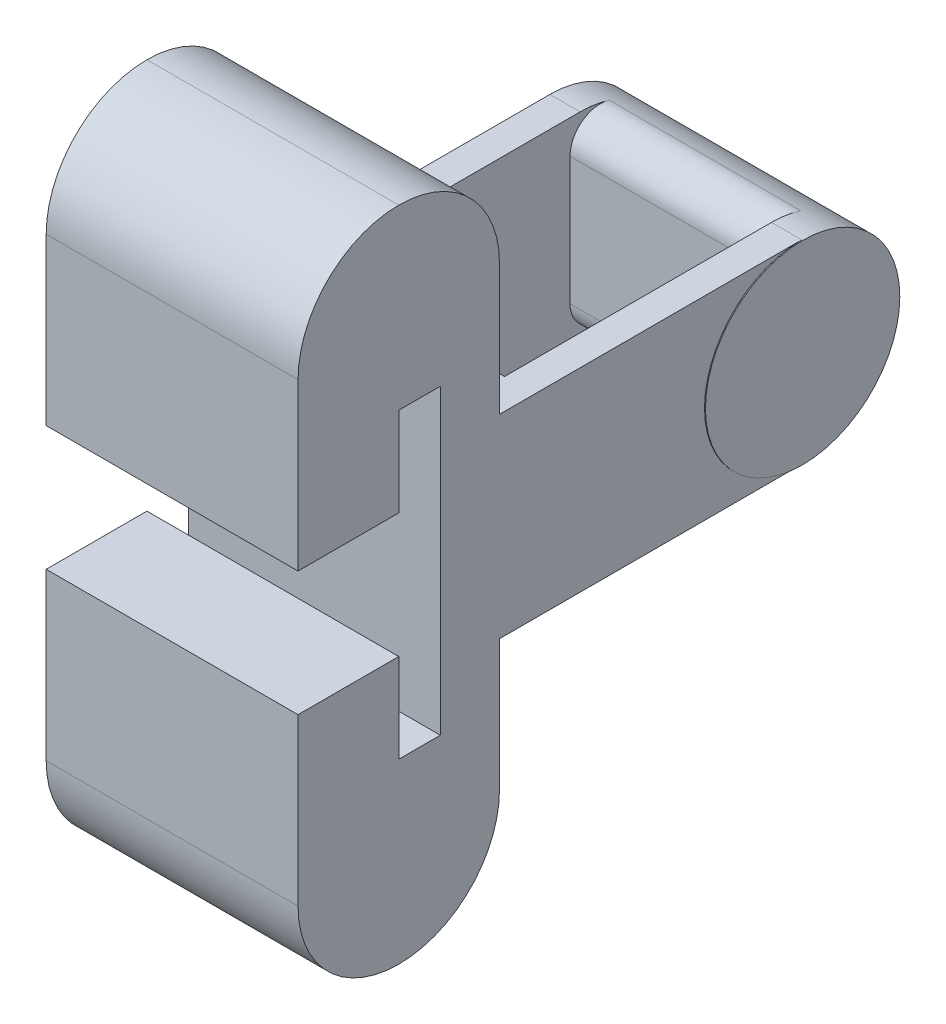
from build123d import *

# Parameters (mm, degrees)
SKETCH1_R            = 24.505905818
BOSS_EXTRUDE1_DEPTH  = 0.2286
BOSS_EXTRUDE2_START  = 63.5
BOSS_EXTRUDE2_DEPTH  = 63.5
SKETCH4_W            = 63.5
SKETCH4_H            = 76.2
BOSS_EXTRUDE4_DEPTH  = 14.929782549
SKETCH5_W            = 63.5
SKETCH5_H            = 50.8
BOSS_EXTRUDE5_DEPTH  = 44.789347647
FILLET2_R            = 25.4
SKETCH7_W            = 63.5
SKETCH7_H            = 25.4
BOSS_EXTRUDE7_DEPTH  = 22.41804
FILLET2_OF_MIRROR1_R = 25.4
SKETCH10_W           = 48.26
SKETCH10_H           = 64.77
CUT_EXTRUDE2_DEPTH   = 179.030869421
FILLET3_R            = 7.62


# Some blends are built 0.0001 mm under size
with BuildPart() as part:
    # Sketch1 → Boss-Extrude1 (new body)
    with BuildSketch(Plane.YZ):
        with Locations(Location((0, 0, 0), (0, 0, 270))):
            Circle(SKETCH1_R)
    extrude(amount=BOSS_EXTRUDE1_DEPTH)

    # Sketch2 → Boss-Extrude2 (add)
    with BuildSketch(Plane(origin=(0, 0, 0), x_dir=(0, -1, 0), z_dir=(-1, 0, 0)).offset(BOSS_EXTRUDE2_START)):
        with BuildLine():
            Line((-24.505905818, 0), (-24.505905818, 76.2))
            Line((-24.505905818, 76.2), (24.505905818, 76.2))
            Line((24.505905818, 76.2), (24.505905818, 0))
            ThreePointArc((24.505905818, 0), (0, -24.505905818), (-24.505905818, 0))
        make_face()
    extrude(amount=-BOSS_EXTRUDE2_DEPTH)

    # Sketch4 → Boss-Extrude4 (add)
    with BuildSketch(Plane.XY.offset(76.2)):
        with Locations((-31.75, 0)):
            Rectangle(SKETCH4_W, SKETCH4_H)
    extrude(amount=BOSS_EXTRUDE4_DEPTH)

    # Sketch5 → Boss-Extrude5 (add)
    with BuildSketch(Plane(origin=(0, 38.1, 0), x_dir=(-1, 0, 0), z_dir=(0, 1, 0))):
        with Locations((31.75, 101.6)):
            Rectangle(SKETCH5_W, SKETCH5_H)
    boss_extrude5 = extrude(amount=BOSS_EXTRUDE5_DEPTH)

    # Fillet2
    fillet2_edges = [part.edges().sort_by_distance(p)[0] for p in [
        (-31.75, 82.889347647, 76.2),
        (-31.75, 82.889347647, 127),
    ]]
    fillet(fillet2_edges, radius=FILLET2_R - 0.0001)  # a hair under: the kernel refuses the full size

    # Sketch7 → Boss-Extrude7 (add)
    with BuildSketch(Plane.XZ.offset(-38.1)):
        with Locations((-31.75, 114.3)):
            Rectangle(SKETCH7_W, SKETCH7_H)
    boss_extrude7 = extrude(amount=BOSS_EXTRUDE7_DEPTH)

    # Mirror1: Boss-Extrude5, Boss-Extrude7 across plane
    add(boss_extrude5.mirror(Plane.ZX))
    add(boss_extrude7.mirror(Plane.ZX))

    # Fillet2 of Mirror1
    fillet2_of_mirror1_edges = [part.edges().sort_by_distance(p)[0] for p in [
        (-31.75, -82.889347647, 76.2),
        (-31.75, -82.889347647, 127),
    ]]
    fillet(fillet2_of_mirror1_edges, radius=FILLET2_OF_MIRROR1_R - 0.0001)  # a hair under: the kernel refuses the full size

    # Sketch10 → Cut-Extrude2 (cut, through all)
    with BuildSketch(Plane(origin=(0, 24.505905818, 0), x_dir=(-1, 0, 0), z_dir=(0, 1, 0))):
        with Locations((31.75, 34.925)):
            Rectangle(SKETCH10_W, SKETCH10_H)
    extrude(amount=-CUT_EXTRUDE2_DEPTH, mode=Mode.SUBTRACT)

    # Fillet3
    # the kernel refuses this fillet: 7.62 mm, written as the material it takes off along each edge
    with BuildSketch(Plane(origin=(-7.62, -24.505905818, 2.54), x_dir=(0, 0.11378574923272014, -0.9935053111441069), z_dir=(-1, 0, 0))) as fillet3_piece_1:
        with BuildLine():
            CenterArc((8.526567897, -7.480642321), FILLET3_R, 79.025374556, 107.50821933)
            Line((0.956057426, -8.34768973), (0.199006379, -8.434394471))
            Line((0.199006379, -8.434394471), (-0.757051047, -0.086704741))
            Line((-0.757051047, -0.086704741), (-0.086704741, 0.757051047))
            ThreePointArc((-0.086704741, 0.757051047), (2.436798749, 1.04606685), (10.122284809, 0.748064232))
            Line((10.122284809, 0.748064232), (9.977219635, 0))
        make_face()
    extrude(amount=48.26, mode=Mode.SUBTRACT)
    with BuildSketch(Plane(origin=(-7.62, 24.505905818, 2.54), x_dir=(0, -0.11378574923272022, -0.9935053111441069), z_dir=(-1, 0, 0))) as fillet3_piece_2:
        with BuildLine():
            CenterArc((8.526567897, 7.480642321), FILLET3_R, 173.466406113, 107.50821933)
            Line((0.956057426, 8.34768973), (0.199006379, 8.434394471))
            Line((0.199006379, 8.434394471), (-0.757051047, 0.086704741))
            Line((-0.757051047, 0.086704741), (-0.086704741, -0.757051047))
            ThreePointArc((-0.086704741, -0.757051047), (2.436798749, -1.04606685), (10.122284809, -0.748064232))
            Line((10.122284809, -0.748064232), (9.977219635, 0))
        make_face()
    extrude(amount=48.26, mode=Mode.SUBTRACT)


solid = part.part
